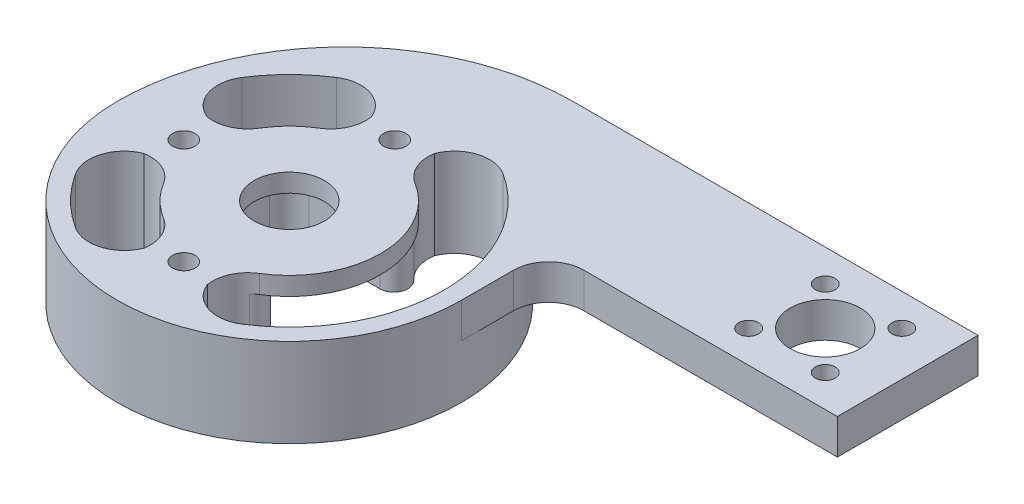
from build123d import *

# Parameters (mm, degrees)
SKETCH1_R           = 31.0896
BOSS_EXTRUDE1_DEPTH = 16.002
BOSS_EXTRUDE2_START = -6.35
BOSS_EXTRUDE2_DEPTH = 6.35
FILLET2_R           = 6.35
CUT_EXTRUDE2_REACH  = 96.198
SKETCH4_R           = 1.778
SKETCH4_R_2         = 6.35
SKETCH7_R           = 2.0193
CUT_EXTRUDE4_DEPTH  = 95.197625109
FILLET7_R           = 6.35
FILLET8_R           = 41.148
CUT_EXTRUDE5_DEPTH  = 12.7
FILLET9_R           = 2.54
SKETCH9_R           = 6.35
CUT_EXTRUDE6_DEPTH  = 3.302
FILLET10_R          = 3.556


# Some blends are built 0.0001 mm under size
with BuildPart() as part:
    # Sketch1 → Boss-Extrude1 (new body)
    with BuildSketch(Plane(origin=(0, 0, 0), x_dir=(1, 0, 0), z_dir=(0, 1, 0))):
        with Locations(Location((0, 0, 0), (0, 0, 270))):
            Circle(SKETCH1_R)
    extrude(amount=BOSS_EXTRUDE1_DEPTH)

    # Sketch2 → Boss-Extrude2 (add)
    with BuildSketch(Plane(origin=(0, 16.002, 0), x_dir=(1, 0, 0), z_dir=(0, 1, 0)).offset(BOSS_EXTRUDE2_START)):
        with BuildLine():
            Line((-31.0896, 0), (-31.0896, 41.148))
            Line((-31.0896, 41.148), (83.2104, 41.148))
            Line((83.2104, 41.148), (83.2104, 15.748))
            Line((83.2104, 15.748), (31.0896, 15.748))
            Line((31.0896, 15.748), (31.0896, 0))
            ThreePointArc((31.0896, 0), (0, -31.0896), (-31.0896, 0))
        make_face()
    extrude(amount=BOSS_EXTRUDE2_DEPTH)

    # Fillet2
    fillet2_edges = [part.edges().sort_by_distance(p)[0] for p in [
        (31.0896, 12.827, -15.748),
    ]]
    fillet(fillet2_edges, radius=FILLET2_R)

    # Sketch4 → Cut-Extrude2 (cut, up to next)
    with BuildSketch(Plane(origin=(0, 16.002, 0), x_dir=(1, 0, 0), z_dir=(0, 1, 0)), mode=Mode.PRIVATE) as cut_extrude2_sk1:
        with Locations(Location((61.411202787, 35.362797213, 0), (0, 0, 270))):
            Circle(SKETCH4_R)
    cut_extrude2_tool1 = extrude(cut_extrude2_sk1.sketch, amount=-CUT_EXTRUDE2_REACH, mode=Mode.PRIVATE) & part.part
    # Sketch4 → Cut-Extrude2 (cut, up to next)
    with BuildSketch(Plane(origin=(0, 16.002, 0), x_dir=(1, 0, 0), z_dir=(0, 1, 0)), mode=Mode.PRIVATE) as cut_extrude2_sk2:
        with Locations(Location((75.240797213, 35.362797213, 0), (0, 0, 270))):
            Circle(SKETCH4_R)
    cut_extrude2_tool2 = extrude(cut_extrude2_sk2.sketch, amount=-CUT_EXTRUDE2_REACH, mode=Mode.PRIVATE) & part.part
    # Sketch4 → Cut-Extrude2 (cut, up to next)
    with BuildSketch(Plane(origin=(0, 16.002, 0), x_dir=(1, 0, 0), z_dir=(0, 1, 0)), mode=Mode.PRIVATE) as cut_extrude2_sk3:
        with Locations(Location((75.240797213, 21.533202787, 0), (0, 0, 270))):
            Circle(SKETCH4_R)
    cut_extrude2_tool3 = extrude(cut_extrude2_sk3.sketch, amount=-CUT_EXTRUDE2_REACH, mode=Mode.PRIVATE) & part.part
    # Sketch4 → Cut-Extrude2 (cut, up to next)
    with BuildSketch(Plane(origin=(0, 16.002, 0), x_dir=(1, 0, 0), z_dir=(0, 1, 0)), mode=Mode.PRIVATE) as cut_extrude2_sk4:
        with Locations(Location((68.326, 28.448, 0), (0, 0, 270))):
            Circle(SKETCH4_R_2)
    cut_extrude2_tool4 = extrude(cut_extrude2_sk4.sketch, amount=-CUT_EXTRUDE2_REACH, mode=Mode.PRIVATE) & part.part
    # Sketch4 → Cut-Extrude2 (cut, up to next)
    with BuildSketch(Plane(origin=(0, 16.002, 0), x_dir=(1, 0, 0), z_dir=(0, 1, 0)), mode=Mode.PRIVATE) as cut_extrude2_sk5:
        with Locations(Location((61.411202787, 21.533202787, 0), (0, 0, 270))):
            Circle(SKETCH4_R)
    cut_extrude2_tool5 = extrude(cut_extrude2_sk5.sketch, amount=-CUT_EXTRUDE2_REACH, mode=Mode.PRIVATE) & part.part
    add(cut_extrude2_tool1.solids().sort_by_distance((61.411203, 16.002, -35.362797))[0], mode=Mode.SUBTRACT)
    add(cut_extrude2_tool2.solids().sort_by_distance((75.240797, 16.002, -35.362797))[0], mode=Mode.SUBTRACT)
    add(cut_extrude2_tool3.solids().sort_by_distance((75.240797, 16.002, -21.533203))[0], mode=Mode.SUBTRACT)
    add(cut_extrude2_tool4.solids().sort_by_distance((68.326, 16.002, -28.448))[0], mode=Mode.SUBTRACT)
    add(cut_extrude2_tool5.solids().sort_by_distance((61.411203, 16.002, -21.533203))[0], mode=Mode.SUBTRACT)

    # Sketch7 → Cut-Extrude4 (cut, through all)
    with BuildSketch(Plane(origin=(0, 0, 0), x_dir=(1, 0, 0), z_dir=(0, 1, 0))):
        with BuildLine():
            ThreePointArc((27.94, 0), (22.235278576, 16.918510179), (7.450666667, 26.928259621))
            Line((7.450666667, 26.928259621), (4.402666667, 15.912153412))
            ThreePointArc((4.402666667, 15.912153412), (13.139028249, 9.997301469), (16.51, 0))
            ThreePointArc((16.51, 0), (13.139028249, -9.997301469), (4.402666667, -15.912153412))
            Line((4.402666667, -15.912153412), (7.450666667, -26.928259621))
            ThreePointArc((7.450666667, -26.928259621), (22.235278576, -16.918510179), (27.94, 0))
        make_face()
        with BuildLine():
            Line((-15.912153412, -4.402666667), (-26.928259621, -7.450666667))
            ThreePointArc((-26.928259621, -7.450666667), (-19.756563466, -19.756563466), (-7.450666667, -26.928259621))
            Line((-7.450666667, -26.928259621), (-4.402666667, -15.912153412))
            ThreePointArc((-4.402666667, -15.912153412), (-11.674332957, -11.674332957), (-15.912153412, -4.402666667))
        make_face()
        with BuildLine():
            Line((-4.402666667, 15.912153412), (-7.450666667, 26.928259621))
            ThreePointArc((-7.450666667, 26.928259621), (-19.756563466, 19.756563466), (-26.928259621, 7.450666667))
            Line((-26.928259621, 7.450666667), (-15.912153412, 4.402666667))
            ThreePointArc((-15.912153412, 4.402666667), (-11.674332957, 11.674332957), (-4.402666667, 15.912153412))
        make_face()
        with Locations(Location((-19.05, 0, 0), (0, 0, 270))):
            Circle(SKETCH7_R)
        with Locations(Location((0, -19.05, 0), (0, 0, 270))):
            Circle(SKETCH7_R)
        with Locations(Location((0, 19.05, 0), (0, 0, 270))):
            Circle(SKETCH7_R)
    extrude(amount=CUT_EXTRUDE4_DEPTH, mode=Mode.SUBTRACT)

    # Fillet7
    # the kernel refuses this fillet: 6.35 mm, written as the material it adds along each edge
    with BuildSketch(Plane(origin=(-26.928259621, 0, -7.450666667), x_dir=(0.40702884348062, 0, -0.9134153056385845), z_dir=(0, 1, 0)), Plane(origin=(-7.450666667, 0, 26.928259621), x_dir=(-0.9134153056385848, 0, -0.40702884348061963), z_dir=(0, 1, 0))) as fillet7_piece_1:
        with BuildLine():
            CenterArc((7.365726845, -6.279391075), FILLET7_R, 81.447682412, 107.104635177)
            Line((1.086335771, -7.223715029), (0, 0))
            ThreePointArc((0, 0), (4.1550254, 0.310679271), (8.3100508, 0))
        make_face()
    extrude(amount=16.002)
    with BuildSketch(Plane(origin=(-7.450666667, 0, -26.928259621), x_dir=(0.26666666666666705, 0, 0.9637888196533972), z_dir=(0, 1, 0)), Plane(origin=(7.450666667, 0, 26.928259621), x_dir=(-0.26666666666666733, 0, -0.9637888196533971), z_dir=(0, 1, 0)), Plane(origin=(-26.928259621, 0, 7.450666667), x_dir=(0.9637888196533975, 0, -0.26666666666666644), z_dir=(0, 1, 0))) as fillet7_piece_2:
        with BuildLine():
            CenterArc((7.304942452, -6.35), FILLET7_R, 90, 107.104635177)
            ThreePointArc((1.235807879, -8.217647059), (0.310679271, -4.1550254), (0, 0))
            Line((0, 0), (7.304942452, 0))
        make_face()
    extrude(amount=16.002)
    with BuildSketch(Plane(origin=(-4.402666667, 0, -15.912153412), x_dir=(-0.916852417954672, 0, 0.39922630636103035), z_dir=(0, 1, 0)), Plane(origin=(4.402666667, 0, 15.912153412), x_dir=(0.9168524179546733, 0, -0.39922630636102746), z_dir=(0, 1, 0)), Plane(origin=(-15.912153412, 0, 4.402666667), x_dir=(0.39922630636102946, 0, 0.9168524179546725), z_dir=(0, 1, 0))) as fillet7_piece_3:
        with BuildLine():
            CenterArc((5.522661099, -6.287214109), FILLET7_R, 98.063810107, 73.872379787)
            Line((-0.76455301, -5.396462319), (0, 0))
            ThreePointArc((0, 0), (2.315954654, -0.163243317), (4.631909309, 0))
        make_face()
    extrude(amount=16.002)
    with BuildSketch(Plane(origin=(4.402666667, 0, -15.912153412), x_dir=(0.26666666666666416, 0, -0.9637888196533979), z_dir=(0, 1, 0))) as fillet7_piece_4:
        with BuildLine():
            CenterArc((5.450352912, -6.35), FILLET7_R, 90, 73.872379787)
            ThreePointArc((-0.649745119, -4.586111111), (-0.163243317, -2.315954654), (0, 0))
            Line((0, 0), (5.450352912, 0))
        make_face()
    extrude(amount=16.002)
    with BuildSketch(Plane(origin=(7.450666667, 0, -26.928259621), x_dir=(-0.2666666666666666, 0, 0.9637888196533974), z_dir=(0, 1, 0))) as fillet7_piece_5:
        with BuildLine():
            CenterArc((7.304942452, 6.35), FILLET7_R, 162.895364823, 107.104635177)
            ThreePointArc((1.235807879, 8.217647059), (0.310679271, 4.1550254), (0, 0))
            Line((0, 0), (7.304942452, 0))
        make_face()
    extrude(amount=16.002)
    with BuildSketch(Plane(origin=(-4.402666667, 0, 15.912153412), x_dir=(-0.9168524179546729, 0, -0.3992263063610288), z_dir=(0, 1, 0)), Plane(origin=(-15.912153412, 0, -4.402666667), x_dir=(0.39922630636102996, 0, -0.9168524179546723), z_dir=(0, 1, 0))) as fillet7_piece_6:
        with BuildLine():
            CenterArc((5.522661099, 6.287214109), FILLET7_R, 188.063810107, 73.872379787)
            Line((-0.76455301, 5.396462319), (0, 0))
            ThreePointArc((0, 0), (2.315954654, 0.163243317), (4.631909309, 0))
        make_face()
    extrude(amount=16.002)

    # Fillet8
    fillet8_edges = [part.edges().sort_by_distance(p)[0] for p in [
        (-31.0896, 12.827, -41.148),
    ]]
    fillet(fillet8_edges, radius=FILLET8_R - 0.0001)  # a hair under: the kernel refuses the full size

    # Sketch8 → Cut-Extrude5 (cut)
    with BuildSketch(Plane.XZ):
        with BuildLine():
            Line((-10.414, 10.414), (10.414, 10.414))
            ThreePointArc((10.414, 10.414), (20.828, 0), (10.414, -10.414))
            Line((10.414, -10.414), (-10.414, -10.414))
            Line((-10.414, -10.414), (-10.414, 10.414))
        make_face()
    extrude(amount=-CUT_EXTRUDE5_DEPTH, mode=Mode.SUBTRACT)

    # Fillet9
    # the kernel refuses this fillet: 2.54 mm, written as the material it takes off along each edge
    with BuildSketch(Plane(origin=(13.087195122, 12.7, 10.065059555), x_dir=(-0.7525451578932851, 0, 0.658540648199768), z_dir=(0, -1, 0))) as fillet9_piece_1:
        with BuildLine():
            CenterArc((7.288242174, 2.538935053), FILLET9_R, 131.188669075, 137.152126286)
            Line((5.615548928, 4.450399754), (5.448279603, 4.641546224))
            ThreePointArc((5.448279603, 4.641546224), (2.074222188, 1.688960676), (-0.1125988, 0.227678524))
            Line((-0.1125988, 0.227678524), (-0.049545453, -0.249120951))
            ThreePointArc((-0.049545453, -0.249120951), (6.014734512, -0.336617786), (7.207343199, -0.253893505))
            Line((7.207343199, -0.253893505), (7.214697651, 0))
        make_face()
    extrude(amount=30.736744128, mode=Mode.SUBTRACT)
    with BuildSketch(Plane(origin=(13.087195122, 12.7, -10.065059555), x_dir=(-0.7525451578933744, 0, -0.658540648199666), z_dir=(0, -1, 0))) as fillet9_piece_2:
        with BuildLine():
            CenterArc((7.288242174, -2.538935053), FILLET9_R, 91.659204639, 137.152126286)
            Line((5.615548928, -4.450399754), (5.448279603, -4.641546224))
            ThreePointArc((5.448279603, -4.641546224), (2.074222188, -1.688960676), (-0.1125988, -0.227678524))
            Line((-0.1125988, -0.227678524), (-0.049545453, 0.249120951))
            ThreePointArc((-0.049545453, 0.249120951), (6.014734512, 0.336617786), (7.207343199, 0.253893505))
            Line((7.207343199, 0.253893505), (7.214697651, 0))
        make_face()
    extrude(amount=30.736744128, mode=Mode.SUBTRACT)

    # Sketch9 → Cut-Extrude6 (cut)
    with BuildSketch(Plane.XZ.offset(-12.7)):
        with Locations(Location((0, 0, 0), (0, 0, 270))):
            Circle(SKETCH9_R)
    extrude(amount=-CUT_EXTRUDE6_DEPTH, mode=Mode.SUBTRACT)

    # Fillet10
    fillet10_edges = [part.edges().sort_by_distance(p)[0] for p in [
        (-10.414, 6.35, -10.414),
        (-10.414, 6.35, 10.414),
    ]]
    fillet(fillet10_edges, radius=FILLET10_R)


solid = part.part
